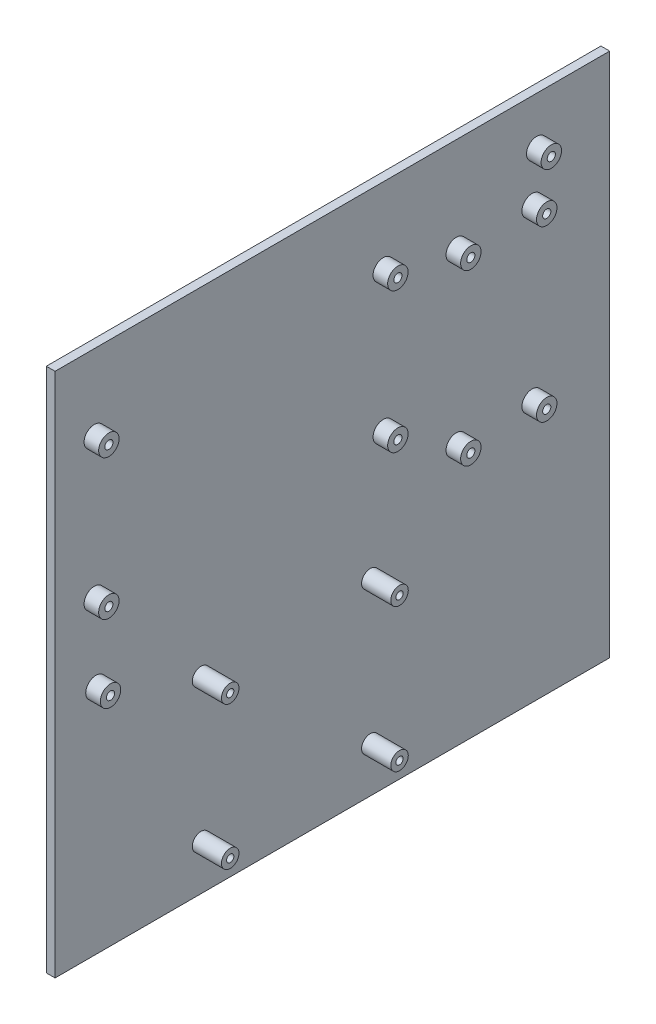
from build123d import *

# Parameters (mm, degrees)
SKETCH1_W           = 190
SKETCH1_H           = 180
BOSS_EXTRUDE1_DEPTH = 3
SKETCH2_R           = 3.5
SKETCH2_R_2         = 1.4
BOSS_EXTRUDE2_DEPTH = 5
SKETCH3_R           = 3
SKETCH3_R_2         = 1.25
BOSS_EXTRUDE3_DEPTH = 10


with BuildPart() as part:
    # Sketch1 → Boss-Extrude1 (new body)
    with BuildSketch(Plane(origin=(0, 0, 0), x_dir=(0, 0, -1), z_dir=(1, 0, 0))):
        Rectangle(SKETCH1_W, SKETCH1_H)
    extrude(amount=BOSS_EXTRUDE1_DEPTH)

    # Sketch2 → Boss-Extrude2 (add)
    # profile 1 of 10: a face of its own
    with BuildSketch(Plane(origin=(3, 0, 0), x_dir=(0, 0, -1), z_dir=(1, 0, 0))):
        with Locations((-81, -10.7)):
            Circle(SKETCH2_R)
        with Locations((-81, -10.7)):
            Circle(SKETCH2_R_2, mode=Mode.SUBTRACT)
    # profile 2 of 10: a face of its own
    with BuildSketch(Plane(origin=(3, 0, 0), x_dir=(0, 0, -1), z_dir=(1, 0, 0))):
        with Locations((70, 73.7)):
            Circle(SKETCH2_R)
        with Locations((70, 73.7)):
            Circle(SKETCH2_R_2, mode=Mode.SUBTRACT)
    # profile 3 of 10: a face of its own
    with BuildSketch(Plane(origin=(3, 0, 0), x_dir=(0, 0, -1), z_dir=(1, 0, 0))):
        with Locations((-81.563741741, 64)):
            Circle(SKETCH2_R)
        with Locations((-81.563741741, 64)):
            Circle(SKETCH2_R_2, mode=Mode.SUBTRACT)
    # profile 4 of 10: a face of its own
    with BuildSketch(Plane(origin=(3, 0, 0), x_dir=(0, 0, -1), z_dir=(1, 0, 0))):
        with Locations((17.436258259, 64)):
            Circle(SKETCH2_R)
        with Locations((17.436258259, 64)):
            Circle(SKETCH2_R_2, mode=Mode.SUBTRACT)
    # profile 5 of 10: a face of its own
    with BuildSketch(Plane(origin=(3, 0, 0), x_dir=(0, 0, -1), z_dir=(1, 0, 0))):
        with Locations((42.436258259, 57.531127093)):
            Circle(SKETCH2_R)
        with Locations((42.436258259, 57.531127093)):
            Circle(SKETCH2_R_2, mode=Mode.SUBTRACT)
    # profile 6 of 10: a face of its own
    with BuildSketch(Plane(origin=(3, 0, 0), x_dir=(0, 0, -1), z_dir=(1, 0, 0))):
        with Locations((68.436258259, 57.531127093)):
            Circle(SKETCH2_R)
        with Locations((68.436258259, 57.531127093)):
            Circle(SKETCH2_R_2, mode=Mode.SUBTRACT)
    # profile 7 of 10: a face of its own
    with BuildSketch(Plane(origin=(3, 0, 0), x_dir=(0, 0, -1), z_dir=(1, 0, 0))):
        with Locations((42.436258259, -0.468872907)):
            Circle(SKETCH2_R)
        with Locations((42.436258259, -0.468872907)):
            Circle(SKETCH2_R_2, mode=Mode.SUBTRACT)
    # profile 8 of 10: a face of its own
    with BuildSketch(Plane(origin=(3, 0, 0), x_dir=(0, 0, -1), z_dir=(1, 0, 0))):
        with Locations((68.436258259, -0.468872907)):
            Circle(SKETCH2_R)
        with Locations((68.436258259, -0.468872907)):
            Circle(SKETCH2_R_2, mode=Mode.SUBTRACT)
    # profile 9 of 10: a face of its own
    with BuildSketch(Plane(origin=(3, 0, 0), x_dir=(0, 0, -1), z_dir=(1, 0, 0))):
        with Locations((17.436258259, 16)):
            Circle(SKETCH2_R)
        with Locations((17.436258259, 16)):
            Circle(SKETCH2_R_2, mode=Mode.SUBTRACT)
    # profile 10 of 10: a face of its own
    with BuildSketch(Plane(origin=(3, 0, 0), x_dir=(0, 0, -1), z_dir=(1, 0, 0))):
        with Locations((-81.563741741, 16)):
            Circle(SKETCH2_R)
        with Locations((-81.563741741, 16)):
            Circle(SKETCH2_R_2, mode=Mode.SUBTRACT)
    extrude(amount=BOSS_EXTRUDE2_DEPTH)

    # Sketch3 → Boss-Extrude3 (add)
    # profile 1 of 4: a face of its own
    with BuildSketch(Plane(origin=(3, 0, 0), x_dir=(0, 0, -1), z_dir=(1, 0, 0))):
        with Locations((-45, -25.5)):
            Circle(SKETCH3_R)
        with Locations((-45, -25.5)):
            Circle(SKETCH3_R_2, mode=Mode.SUBTRACT)
    # profile 2 of 4: a face of its own
    with BuildSketch(Plane(origin=(3, 0, 0), x_dir=(0, 0, -1), z_dir=(1, 0, 0))):
        with Locations((13, -25.5)):
            Circle(SKETCH3_R)
        with Locations((13, -25.5)):
            Circle(SKETCH3_R_2, mode=Mode.SUBTRACT)
    # profile 3 of 4: a face of its own
    with BuildSketch(Plane(origin=(3, 0, 0), x_dir=(0, 0, -1), z_dir=(1, 0, 0))):
        with Locations((-45, -74.5)):
            Circle(SKETCH3_R)
        with Locations((-45, -74.5)):
            Circle(SKETCH3_R_2, mode=Mode.SUBTRACT)
    # profile 4 of 4: a face of its own
    with BuildSketch(Plane(origin=(3, 0, 0), x_dir=(0, 0, -1), z_dir=(1, 0, 0))):
        with Locations((13, -74.5)):
            Circle(SKETCH3_R)
        with Locations((13, -74.5)):
            Circle(SKETCH3_R_2, mode=Mode.SUBTRACT)
    extrude(amount=BOSS_EXTRUDE3_DEPTH)


solid = part.part
